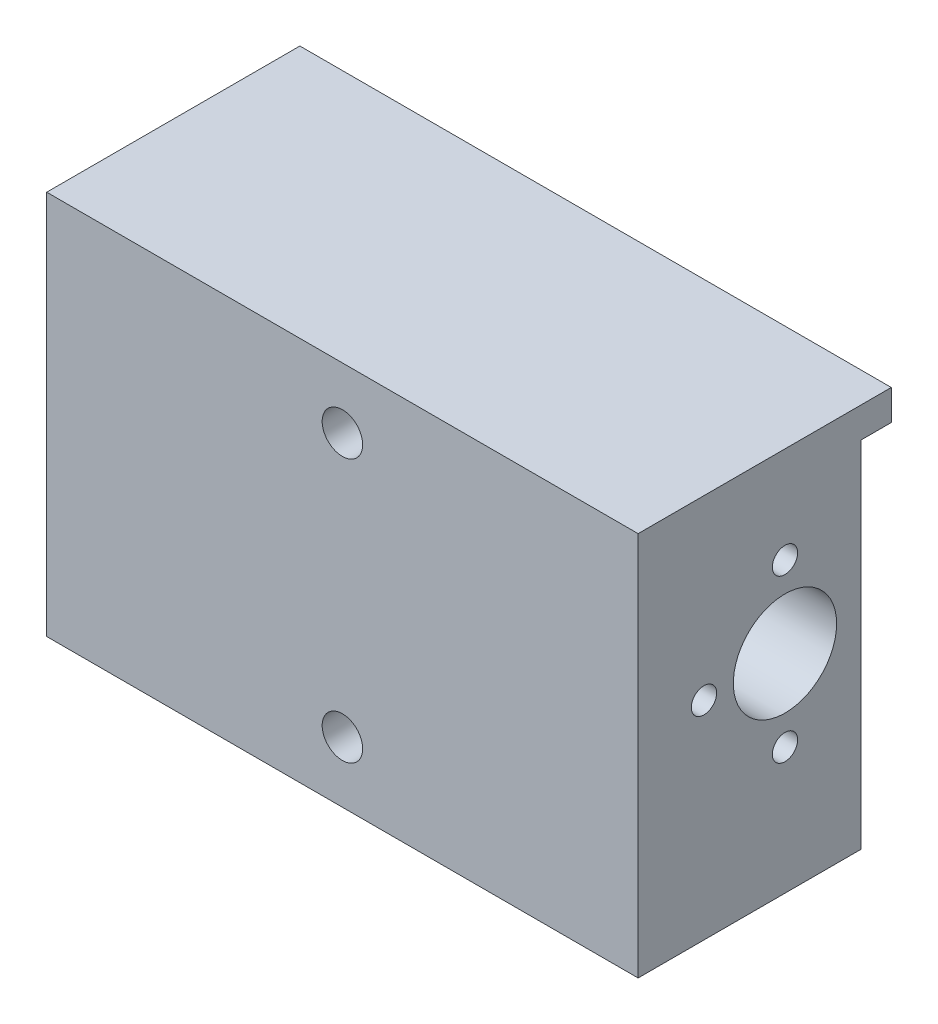
from build123d import *

# Parameters (mm, degrees)
CROQUIS1_W                                     = 58.4
CROQUIS1_H                                     = 38
SALIENTE_EXTRUIR1_DEPTH                        = 22
CROQUIS2_R                                     = 5.1
CORTAR_EXTRUIR1_DEPTH                          = 74.065450112
TALADROS_DE_ESPIGA_DE_4_0MM2_D                 = 4
TALADROS_DE_ESPIGA_DE_4_0MM2_DEPTH             = 14
TALADROS_DE_ESPIGA_DE_4_0MM2_TIP               = 1.201721238
CROQUIS6_W                                     = 58.4
CROQUIS6_H                                     = 3
SALIENTE_EXTRUIR2_DEPTH                        = 3
PERFORADOR_PARA_ROSCAR_PARA_MACHO_DE_ROS_D     = 2.5
PERFORADOR_PARA_ROSCAR_PARA_MACHO_DE_ROS_DEPTH = 14
PERFORADOR_PARA_ROSCAR_PARA_MACHO_DE_ROS_TIP   = 0.751075774


with BuildPart() as part:
    # Croquis1 → Saliente-Extruir1 (new body)
    with BuildSketch(Plane.XY):
        with Locations((29.2, 19)):
            Rectangle(CROQUIS1_W, CROQUIS1_H)
    extrude(amount=SALIENTE_EXTRUIR1_DEPTH)

    # Croquis2 → Cortar-Extruir1 (cut, through all)
    with BuildSketch(Plane(origin=(58.4, 0, 0), x_dir=(0, 0, -1), z_dir=(1, 0, 0))):
        with Locations((-7.5, 20.5)):
            Circle(CROQUIS2_R)
    extrude(amount=-CORTAR_EXTRUIR1_DEPTH, mode=Mode.SUBTRACT)

    # Taladros de espiga de Ø4.0mm2
    with Locations(Plane.XY.offset(22)):
        with Locations((29.2, 6), (29.2, 32)):
            Hole(TALADROS_DE_ESPIGA_DE_4_0MM2_D / 2, depth=TALADROS_DE_ESPIGA_DE_4_0MM2_DEPTH)
            with Locations((0, 0, -(TALADROS_DE_ESPIGA_DE_4_0MM2_DEPTH + TALADROS_DE_ESPIGA_DE_4_0MM2_TIP / 2))):  # 118° drill point
                Cone(0, TALADROS_DE_ESPIGA_DE_4_0MM2_D / 2, TALADROS_DE_ESPIGA_DE_4_0MM2_TIP, mode=Mode.SUBTRACT)

    # Croquis6 → Saliente-Extruir2 (add)
    with BuildSketch(Plane(origin=(0, 0, 0), x_dir=(-1, 0, 0), z_dir=(0, 0, -1))):
        with Locations((-29.2, 36.5)):
            Rectangle(CROQUIS6_W, CROQUIS6_H)
    extrude(amount=SALIENTE_EXTRUIR2_DEPTH)

    # Perforador para roscar para macho de roscar para M32
    with Locations(Plane(origin=(58.4, 0, 0), x_dir=(0, 0, -1), z_dir=(1, 0, 0))):
        with Locations((-15.5, 20.5), (-7.5, 12.5), (-7.5, 28.5)):
            Hole(PERFORADOR_PARA_ROSCAR_PARA_MACHO_DE_ROS_D / 2, depth=PERFORADOR_PARA_ROSCAR_PARA_MACHO_DE_ROS_DEPTH)
            with Locations((0, 0, -(PERFORADOR_PARA_ROSCAR_PARA_MACHO_DE_ROS_DEPTH + PERFORADOR_PARA_ROSCAR_PARA_MACHO_DE_ROS_TIP / 2))):  # 118° drill point
                Cone(0, PERFORADOR_PARA_ROSCAR_PARA_MACHO_DE_ROS_D / 2, PERFORADOR_PARA_ROSCAR_PARA_MACHO_DE_ROS_TIP, mode=Mode.SUBTRACT)


solid = part.part
